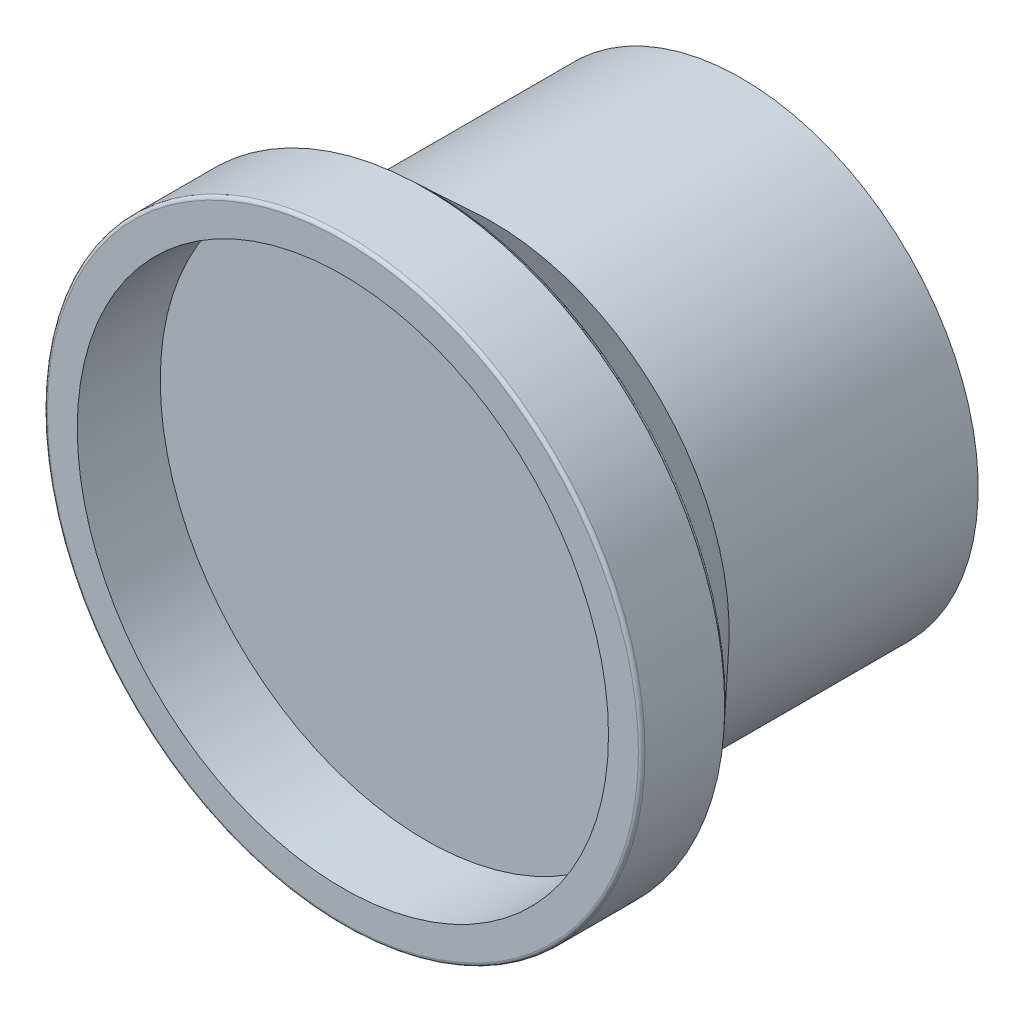
from build123d import *

# Parameters (mm, degrees)
SKETCH2_R           = 900
SKETCH2_R_2         = 800
BOSS_EXTRUDE1_DEPTH = 250
FILLET2_R           = 10
FILLET3_R           = 10
SKETCH4_R           = 712.687606949
SKETCH4_R_2         = 600
BOSS_EXTRUDE2_DEPTH = 750
SKETCH5_R           = 600
BOSS_EXTRUDE3_DEPTH = 700


with BuildPart() as part:
    # Sketch2 → Boss-Extrude1 (new body)
    with BuildSketch(Plane.XY):
        Circle(SKETCH2_R)
        Circle(SKETCH2_R_2, mode=Mode.SUBTRACT)
    extrude(amount=BOSS_EXTRUDE1_DEPTH)

    # Fillet2
    fillet2_edges = [part.edges().sort_by_distance(p)[0] for p in [
        (-900, 0, 250),
    ]]
    fillet(fillet2_edges, radius=FILLET2_R)


with BuildPart() as body_2:
    # Sketch3 → Revolve1 (revolve)
    with BuildSketch(Plane(origin=(0, 0, 0), x_dir=(0, 0, -1), z_dir=(1, 0, 0)), mode=Mode.PRIVATE) as revolve1_sk:
        Polygon((0, 0), (200.705378627, 0), (200.705378627, -712.687606949), (0, -900), align=None)
    revolve(revolve1_sk.sketch.rotate(Axis((0, 0, 0), (0, 0, -1)), 270), axis=Axis((0, 0, 0), (0, 0, -1)))

    # Fillet3
    fillet3_edges = [body_2.edges().sort_by_distance(p)[0] for p in [
        (-900, 0, 0),
    ]]
    fillet(fillet3_edges, radius=FILLET3_R)

    # Sketch4 → Boss-Extrude2 (add)
    with BuildSketch(Plane(origin=(0, 0, -200.705378627), x_dir=(-1, 0, 0), z_dir=(0, 0, -1))):
        Circle(SKETCH4_R)
        Circle(SKETCH4_R_2, mode=Mode.SUBTRACT)
    extrude(amount=BOSS_EXTRUDE2_DEPTH)

    # Sketch5 → Boss-Extrude3 (add)
    with BuildSketch(Plane(origin=(0, 0, -200.705378627), x_dir=(-1, 0, 0), z_dir=(0, 0, -1))):
        Circle(SKETCH5_R)
    extrude(amount=BOSS_EXTRUDE3_DEPTH)


solid = Compound([part.part, body_2.part])
